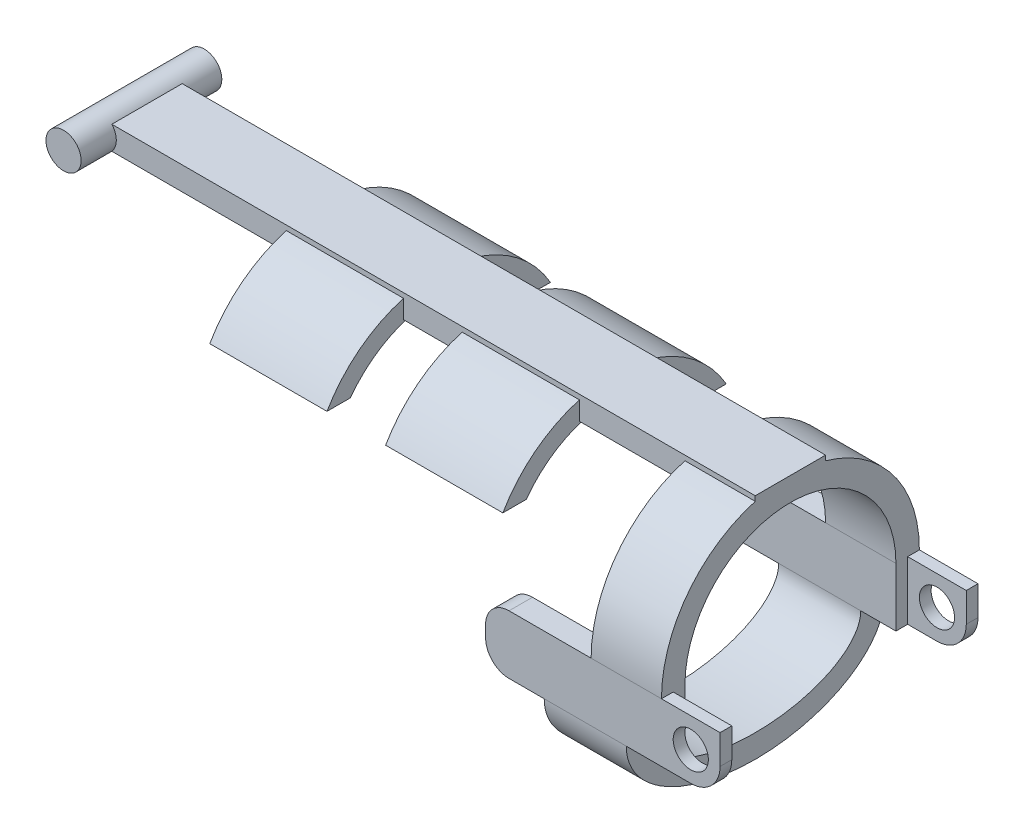
from build123d import *

# Parameters (mm, degrees)
SKETCH1_W                = 2
SKETCH1_H                = 5
BOSS_EXTRUDE1_DEPTH      = 15
BOSS_EXTRUDE1_2_DEPTH    = 15
SKETCH2_W                = 1
SKETCH2_H                = 5
BOSS_EXTRUDE2_DEPTH      = 5
CUT_EXTRUDE1_DEPTH       = 30.107559156
CUT_EXTRUDE1_DEPTH_BACK  = 30.107559156
SKETCH3_R                = 1.5
SWEEP1_START             = 9
SWEEP1_DEPTH             = 6
BOSS_EXTRUDE3_DEPTH      = 12
CUT_EXTRUDE2_DEPTH       = 5
FILLET1_R                = 2
BOSS_EXTRUDE6_START      = -6
SKETCH7_W                = 6
SKETCH7_H                = 2
BOSS_EXTRUDE6_DEPTH      = 56
BOSS_EXTRUDE7_DEPTH      = 3
BOSS_EXTRUDE7_DEPTH_BACK = 9
SKETCH8_R                = 1.5
FILLET2_R                = 2.5
BOSS_EXTRUDE10_DEPTH     = 10
LPATTERN1_COUNT          = 2
LPATTERN1_PITCH          = 15


# Read off the part's stored shape, not the designer's step: Sweep1
with BuildPart() as part:
    # Sketch1 → Boss-Extrude1 (new body)
    with BuildSketch(Plane(origin=(0, 0, 0), x_dir=(0, 0, -1), z_dir=(1, 0, 0))):
        with Locations((-10, 0)):
            Rectangle(SKETCH1_W, SKETCH1_H)
    extrude(amount=BOSS_EXTRUDE1_DEPTH)



with BuildPart() as body_2:
    # Sketch1 → Boss-Extrude1 2 (new body)
    with BuildSketch(Plane(origin=(0, 0, 0), x_dir=(0, 0, -1), z_dir=(1, 0, 0))):
        with Locations((10, 0)):
            Rectangle(SKETCH1_W, SKETCH1_H)
    extrude(amount=BOSS_EXTRUDE1_2_DEPTH)


with BuildPart() as part_1:
    add(part.part)

    add(body_2.part)  # Boss-Extrude2 merges body 2
    # Sketch2 → Boss-Extrude2 (add)
    with BuildSketch(Plane(origin=(15, 0, 0), x_dir=(0, 0, -1), z_dir=(1, 0, 0))):
        with Locations((10.5, 0)):
            Rectangle(SKETCH2_W, SKETCH2_H)
        with Locations((-10.5, 0)):
            Rectangle(SKETCH2_W, SKETCH2_H)
    extrude(amount=BOSS_EXTRUDE2_DEPTH)

    # Sketch3 → Cut-Extrude1 (cut, two sides: drawn at the far end of the back side and taken through both)
    with BuildSketch(Plane.XY.offset(-10).offset(-CUT_EXTRUDE1_DEPTH_BACK)):
        with Locations((17.5, 0)):
            Circle(SKETCH3_R)
    extrude(amount=CUT_EXTRUDE1_DEPTH + CUT_EXTRUDE1_DEPTH_BACK, mode=Mode.SUBTRACT)

    # Sweep1 outline → Sweep1 (add)
    with BuildSketch(Plane.YZ.offset(SWEEP1_START)):
        with BuildLine():
            ThreePointArc((2.5, -11), (13.5, 0), (2.5, 11))
            Line((2.5, 11), (2.5, 9))
            ThreePointArc((2.5, 9), (11.5, 0), (2.5, -9))
            Line((2.5, -9), (2.5, -11))
        make_face()
    extrude(amount=SWEEP1_DEPTH)

    # Sketch5 → Boss-Extrude3 (add)
    with BuildSketch(Plane(origin=(0, 0, 0), x_dir=(0, 0, -1), z_dir=(1, 0, 0))):
        with BuildLine():
            Line((-9, -2.5), (-11, -2.5))
            add(Edge.make_bspline(
                [(-11, -2.5), (-11, -8.980170496), (0, -8.980170496)],
                knots=[3.141592654, 3.141592654, 3.141592654, 4.71238898, 4.71238898, 4.71238898], degree=2, weights=[1, 0.707106781, 1]))
            Line((0, -8.980170496), (0, -7.009343108))
            add(Edge.make_bspline(
                [(-9, -2.5), (-9, -7.009343108), (0, -7.009343108)],
                knots=[3.141592654, 3.141592654, 3.141592654, 4.71238898, 4.71238898, 4.71238898], degree=2, weights=[1, 0.707106781, 1]))
        make_face()
    boss_extrude3 = extrude(amount=BOSS_EXTRUDE3_DEPTH)

    # Sketch6 → Cut-Extrude2 (cut)
    with BuildSketch(Plane.ZY):
        with BuildLine():
            Line((11, -2.5), (9, -2.5))
            add(Edge.make_bspline(
                [(0, -7.009343108), (9, -7.009343108), (9, -2.5)],
                knots=[4.71238898, 4.71238898, 4.71238898, 6.283185307, 6.283185307, 6.283185307], degree=2, weights=[1, 0.707106781, 1]))
            Line((0, -7.009343108), (0, -8.980170496))
            add(Edge.make_bspline(
                [(0, -8.980170496), (11, -8.980170496), (11, -2.5)],
                knots=[4.71238898, 4.71238898, 4.71238898, 6.283185307, 6.283185307, 6.283185307], degree=2, weights=[1, 0.707106781, 1]))
        make_face()
    cut_extrude2 = extrude(amount=-CUT_EXTRUDE2_DEPTH, mode=Mode.SUBTRACT)

    # Mirror2: Boss-Extrude3, Cut-Extrude2 across plane
    add(boss_extrude3.mirror(Plane(origin=(12, -8.980170496, 0), x_dir=(1, 0, 0), z_dir=(0, 0, 1))))
    add(cut_extrude2.mirror(Plane(origin=(12, -8.980170496, 0), x_dir=(1, 0, 0), z_dir=(0, 0, 1))), mode=Mode.SUBTRACT)

    # Fillet1
    fillet1_edges = [part_1.edges().sort_by_distance(p)[0] for p in [
        (0, -2.5, -10),
        (0, 2.5, -10),
        (0, 2.5, 10),
        (0, -2.5, 10),
    ]]
    fillet(fillet1_edges, radius=FILLET1_R)

    # Sketch7 → Boss-Extrude6 (add)
    with BuildSketch(Plane.ZY.offset(-9).offset(BOSS_EXTRUDE6_START)):
        with Locations((0, 12.5)):
            Rectangle(SKETCH7_W, SKETCH7_H)
    extrude(amount=BOSS_EXTRUDE6_DEPTH)

    # Sketch8 → Boss-Extrude7 (add, two sides: drawn at the far end of the back side and taken through both)
    with BuildSketch(Plane.XY.offset(3).offset(-BOSS_EXTRUDE7_DEPTH_BACK)):
        with Locations((-41, 12.5)):
            Circle(SKETCH8_R)
    extrude(amount=BOSS_EXTRUDE7_DEPTH + BOSS_EXTRUDE7_DEPTH_BACK)

    # Fillet2
    fillet2_edges = [part_1.edges().sort_by_distance(p)[0] for p in [
        (20, -2.5, -10.5),
        (20, -2.5, 10.5),
    ]]
    fillet(fillet2_edges, radius=FILLET2_R)

    # 3DSketch3 → Boss-Extrude10 (add)
    with BuildSketch(Plane(origin=(-10, 7.995255445, 9.529017137), x_dir=(0, 0, -1), z_dir=(1, 0, 0))):
        with BuildLine():
            Line((0, 0), (2, 0))
            ThreePointArc((2, 0), (9.529017137, 3.825899604), (17.058034273, 0))
            Line((17.058034273, 0), (19.058034273, 0))
            ThreePointArc((19.058034273, 0), (15.031388903, 4.029654263), (9.529017137, 5.504744555))
            ThreePointArc((9.529017137, 5.504744555), (4.026645371, 4.029654263), (0, 0))
        make_face()
    boss_extrude10 = extrude(amount=BOSS_EXTRUDE10_DEPTH)

    # LPattern1: Boss-Extrude10 ×2
    with Locations(*[(-i * LPATTERN1_PITCH, 0, 0) for i in range(1, LPATTERN1_COUNT)]):
        add(boss_extrude10)


solid = part_1.part
